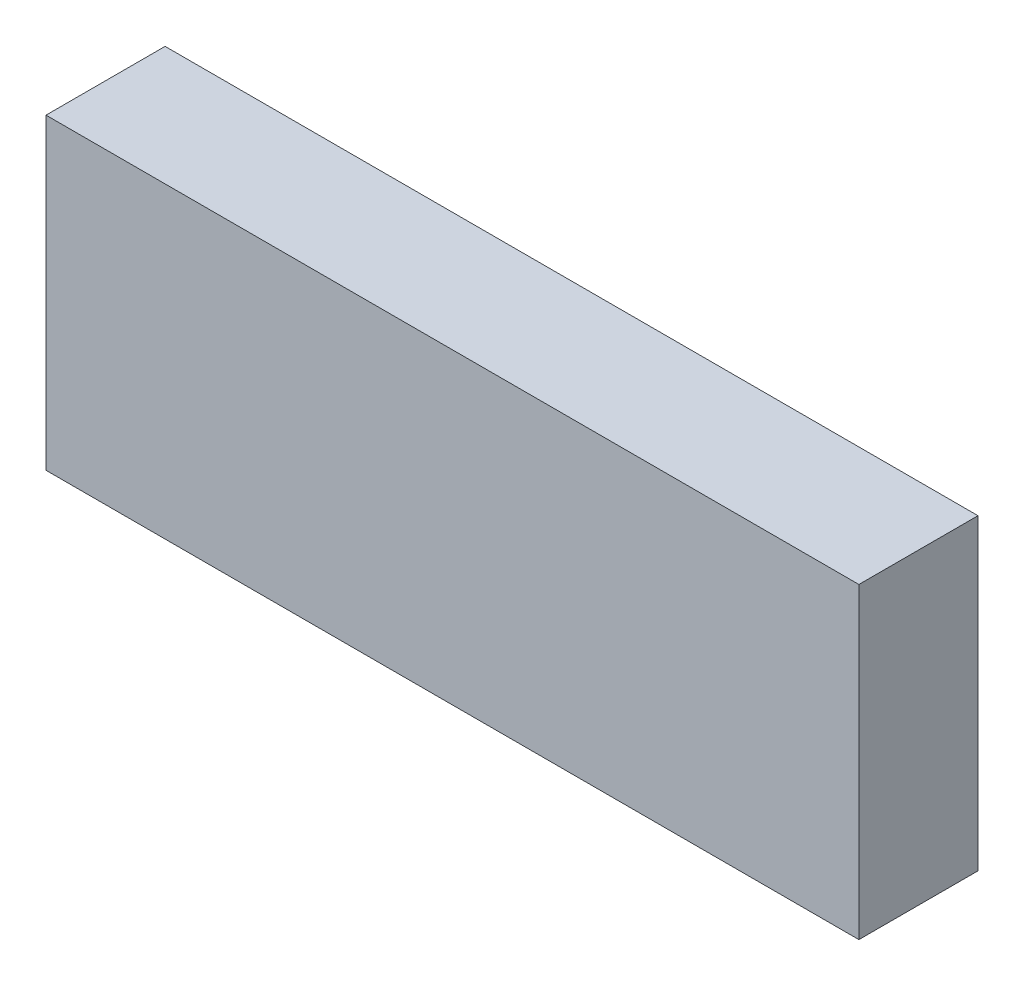
from build123d import *

# Parameters (mm, degrees)
SKETCH1_W           = 69.342
SKETCH1_H           = 26.2382
BOSS_EXTRUDE1_DEPTH = 10.16


with BuildPart() as part:
    # Sketch1 → Boss-Extrude1 (new body)
    with BuildSketch(Plane.XY):
        with Locations((34.671, 13.1191)):
            Rectangle(SKETCH1_W, SKETCH1_H)
    extrude(amount=BOSS_EXTRUDE1_DEPTH)


solid = part.part
